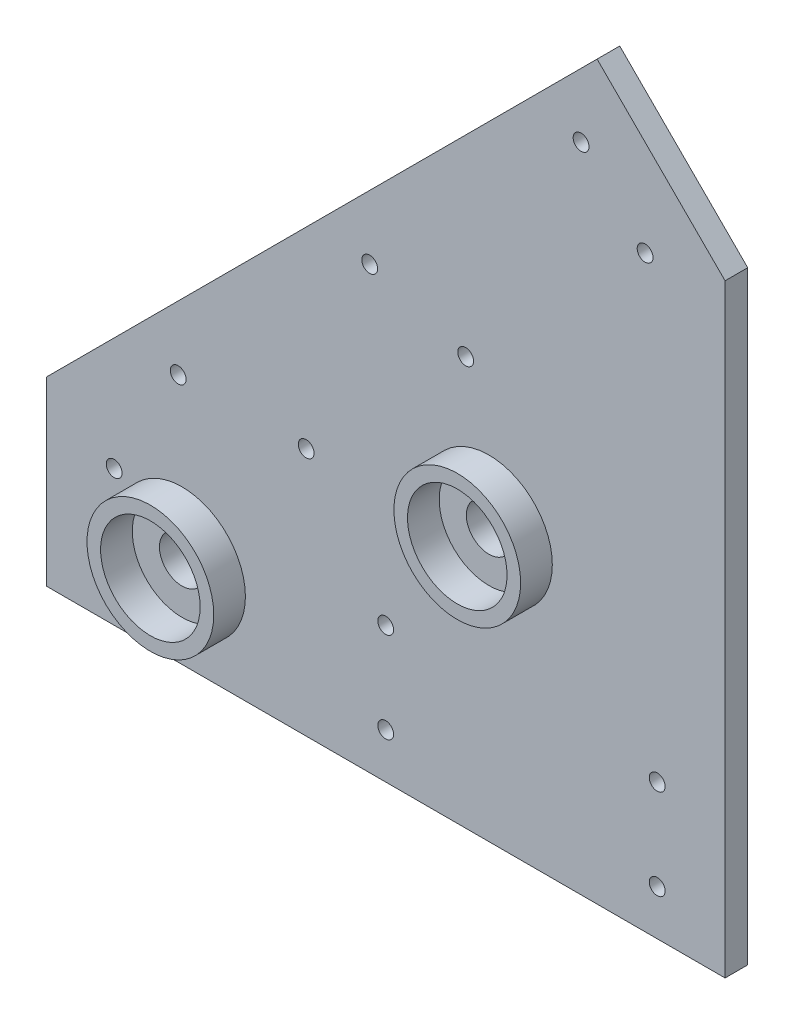
from build123d import *

# Parameters (mm, degrees)
SKETCH1_R           = 1.75
SKETCH1_R_2         = 5
BOSS_EXTRUDE1_DEPTH = 5
SKETCH2_R           = 14
SKETCH2_R_2         = 11
BOSS_EXTRUDE2_DEPTH = 7


with BuildPart() as part:
    # Sketch1 → Boss-Extrude1 (new body)
    with BuildSketch(Plane.XY):
        Polygon((46.715728753, 141.715728753), (-75, 20), (-75, -20), (75, -20), (75, 20), (75, 113.431457505), align=None)
        with Locations((-60, -10)):
            Circle(SKETCH1_R, mode=Mode.SUBTRACT)
        with Locations((-45, 0)):
            Circle(SKETCH1_R_2, mode=Mode.SUBTRACT)
        with Locations((-60, 10)):
            Circle(SKETCH1_R, mode=Mode.SUBTRACT)
        with Locations((0, 10)):
            Circle(SKETCH1_R, mode=Mode.SUBTRACT)
        with Locations((-45.857864376, 35)):
            Circle(SKETCH1_R, mode=Mode.SUBTRACT)
        with Locations((-17.573593129, 35)):
            Circle(SKETCH1_R, mode=Mode.SUBTRACT)
        with Locations((0, -10)):
            Circle(SKETCH1_R, mode=Mode.SUBTRACT)
        with Locations((60, -10)):
            Circle(SKETCH1_R, mode=Mode.SUBTRACT)
        with Locations((60, 10)):
            Circle(SKETCH1_R, mode=Mode.SUBTRACT)
        with Locations((22.819931213, 40)):
            Circle(SKETCH1_R_2, mode=Mode.SUBTRACT)
        with Locations((-3.535533906, 77.32233047)):
            Circle(SKETCH1_R, mode=Mode.SUBTRACT)
        with Locations((17.67766953, 70.251262658)):
            Circle(SKETCH1_R, mode=Mode.SUBTRACT)
        with Locations((57.32233047, 109.895923599)):
            Circle(SKETCH1_R, mode=Mode.SUBTRACT)
        with Locations((43.180194847, 124.038059223)):
            Circle(SKETCH1_R, mode=Mode.SUBTRACT)
    extrude(amount=BOSS_EXTRUDE1_DEPTH)

    # Sketch2 → Boss-Extrude2 (add)
    # profile 1 of 2: a face of its own
    with BuildSketch(Plane.XY.offset(5)):
        with Locations((-45, 0)):
            Circle(SKETCH2_R)
        with Locations((-45, 0)):
            Circle(SKETCH2_R_2, mode=Mode.SUBTRACT)
    # profile 2 of 2: a face of its own
    with BuildSketch(Plane.XY.offset(5)):
        with Locations((22.819931213, 40)):
            Circle(SKETCH2_R)
        with Locations((22.819931213, 40)):
            Circle(SKETCH2_R_2, mode=Mode.SUBTRACT)
    extrude(amount=BOSS_EXTRUDE2_DEPTH)


solid = part.part
